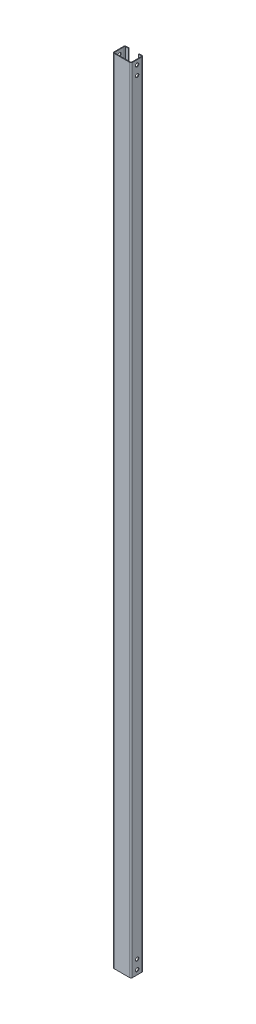
from build123d import *

# Parameters (mm, degrees)
SKETCH1_W                      = 60
SKETCH1_H                      = 2600
BASE_FLANGE1_DEPTH             = 2
EDGE_FLANGE1_STRIP_W           = 13
EDGE_FLANGE1_STRIP_H           = 2
EDGE_FLANGE1_STRIP_CUT_DEPTH   = 2600
EDGE_FLANGE1_STRIP_2_W         = 13
EDGE_FLANGE1_STRIP_2_H         = 2
EDGE_FLANGE1_STRIP_CUT_2_DEPTH = 2600
EDGE_FLANGE1_DEPTH             = 2600
EDGE_FLANGE1_BEND_DEPTH        = 2600
EDGE_FLANGE2_STRIP_W           = 13
EDGE_FLANGE2_STRIP_H           = 2
EDGE_FLANGE2_STRIP_CUT_DEPTH   = 2600
EDGE_FLANGE2_STRIP_2_W         = 13
EDGE_FLANGE2_STRIP_2_H         = 2
EDGE_FLANGE2_STRIP_CUT_2_DEPTH = 2600
EDGE_FLANGE2_DEPTH             = 2600
EDGE_FLANGE2_BEND_DEPTH        = 2600
SKETCH18_R                     = 5.5
CUT_EXTRUDE1_DEPTH             = 1302.998463901


# Sheet-metal steps are written as plain solids
with BuildPart() as part:
    # Sketch1 → Base-Flange1 (new body)
    with BuildSketch(Plane.XY):
        Rectangle(SKETCH1_W, SKETCH1_H)
    extrude(amount=-BASE_FLANGE1_DEPTH)

    # Edge-Flange1 strip (across the edge) → Edge-Flange1 strip cut (cut)
    with BuildSketch(Plane(origin=(30, 1300, -2), x_dir=(-1, 0, 0), z_dir=(0, -1, 0))):
        with Locations((-2, -1)):
            Rectangle(EDGE_FLANGE1_STRIP_W, EDGE_FLANGE1_STRIP_H)
    extrude(amount=EDGE_FLANGE1_STRIP_CUT_DEPTH, mode=Mode.SUBTRACT)

    # Edge-Flange1 strip 2 (across the edge) → Edge-Flange1 strip cut 2 (cut)
    with BuildSketch(Plane(origin=(-30, -1300, -2), x_dir=(1, 0, 0), z_dir=(0, 1, 0))):
        with Locations((-2, -1)):
            Rectangle(EDGE_FLANGE1_STRIP_2_W, EDGE_FLANGE1_STRIP_2_H)
    extrude(amount=EDGE_FLANGE1_STRIP_CUT_2_DEPTH, mode=Mode.SUBTRACT)

    # Edge-Flange1 section (across the edge) → Edge-Flange1 (add)
    with BuildSketch(Plane(origin=(30, 1300, -2), x_dir=(-1, 0, 0), z_dir=(0, -1, 0))):
        with BuildLine():
            Line((0, 2.5), (0, 38))
            Line((0, 38), (2, 38))
            Line((2, 38), (2, 2.5))
            ThreePointArc((2, 2.5), (2.732233047, 0.732233047), (4.5, 0))
            Line((4.5, 0), (4.5, -2))
            ThreePointArc((4.5, -2), (1.318019485, -0.681980515), (0, 2.5))
        make_face()
    extrude(amount=EDGE_FLANGE1_DEPTH)

    # Edge-Flange1 section 2 (across the edge) → Edge-Flange1 bend (add)
    with BuildSketch(Plane(origin=(-30, -1300, -2), x_dir=(1, 0, 0), z_dir=(0, 1, 0))):
        with BuildLine():
            Line((0, 2.5), (0, 38))
            Line((0, 38), (2, 38))
            Line((2, 38), (2, 2.5))
            ThreePointArc((2, 2.5), (2.732233047, 0.732233047), (4.5, 0))
            Line((4.5, 0), (4.5, -2))
            ThreePointArc((4.5, -2), (1.318019485, -0.681980515), (0, 2.5))
        make_face()
    extrude(amount=EDGE_FLANGE1_BEND_DEPTH)

    # Edge-Flange2 strip (across the edge) → Edge-Flange2 strip cut (cut)
    with BuildSketch(Plane(origin=(28, 1300, -40), x_dir=(0, 0, 1), z_dir=(0, -1, 0))):
        with Locations((-2, -1)):
            Rectangle(EDGE_FLANGE2_STRIP_W, EDGE_FLANGE2_STRIP_H)
    extrude(amount=EDGE_FLANGE2_STRIP_CUT_DEPTH, mode=Mode.SUBTRACT)

    # Edge-Flange2 strip 2 (across the edge) → Edge-Flange2 strip cut 2 (cut)
    with BuildSketch(Plane(origin=(-28, -1300, -40), x_dir=(0, 0, 1), z_dir=(0, 1, 0))):
        with Locations((-2, -1)):
            Rectangle(EDGE_FLANGE2_STRIP_2_W, EDGE_FLANGE2_STRIP_2_H)
    extrude(amount=EDGE_FLANGE2_STRIP_CUT_2_DEPTH, mode=Mode.SUBTRACT)

    # Edge-Flange2 section (across the edge) → Edge-Flange2 (add)
    with BuildSketch(Plane(origin=(28, 1300, -40), x_dir=(0, 0, 1), z_dir=(0, -1, 0))):
        with BuildLine():
            Line((0, 2.5), (0, 11))
            Line((0, 11), (2, 11))
            Line((2, 11), (2, 2.5))
            ThreePointArc((2, 2.5), (2.732233047, 0.732233047), (4.5, 0))
            Line((4.5, 0), (4.5, -2))
            ThreePointArc((4.5, -2), (1.318019485, -0.681980515), (0, 2.5))
        make_face()
    extrude(amount=EDGE_FLANGE2_DEPTH)

    # Edge-Flange2 section 2 (across the edge) → Edge-Flange2 bend (add)
    with BuildSketch(Plane(origin=(-28, -1300, -40), x_dir=(0, 0, 1), z_dir=(0, 1, 0))):
        with BuildLine():
            Line((0, 2.5), (0, 11))
            Line((0, 11), (2, 11))
            Line((2, 11), (2, 2.5))
            ThreePointArc((2, 2.5), (2.732233047, 0.732233047), (4.5, 0))
            Line((4.5, 0), (4.5, -2))
            ThreePointArc((4.5, -2), (1.318019485, -0.681980515), (0, 2.5))
        make_face()
    extrude(amount=EDGE_FLANGE2_BEND_DEPTH)

    # Sketch18 → Cut-Extrude1 (cut, symmetric)
    with BuildSketch(Plane(origin=(30, 0, 0), x_dir=(0, 0, -1), z_dir=(1, 0, 0))):
        with Locations(Location((20, 1255, 0), (0, 0, 180))):
            Circle(SKETCH18_R)
        with Locations(Location((20, 1285, 0), (0, 0, 180))):
            Circle(SKETCH18_R)
    cut_extrude1 = extrude(amount=CUT_EXTRUDE1_DEPTH, both=True, mode=Mode.SUBTRACT)

    # Mirror1: Cut-Extrude1 across plane
    add(cut_extrude1.mirror(Plane.ZX), mode=Mode.SUBTRACT)


solid = part.part
